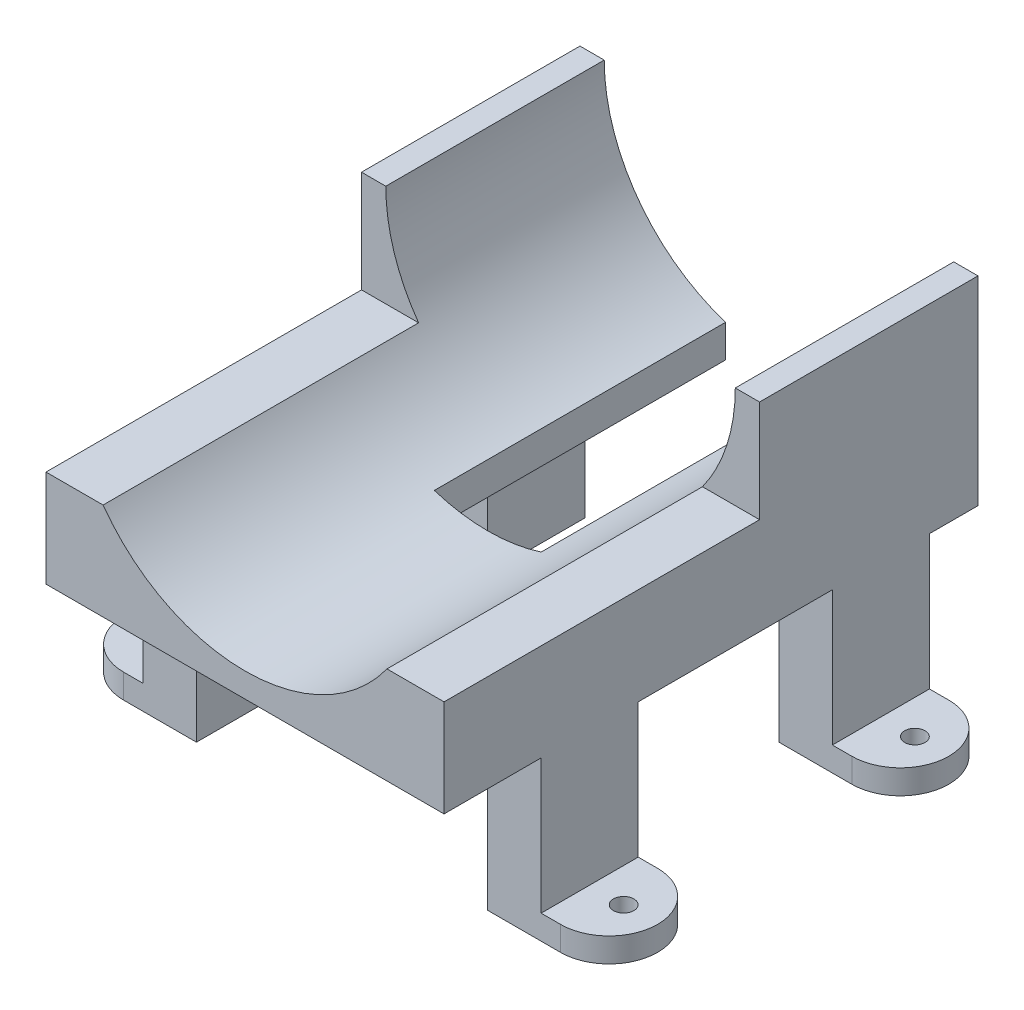
from build123d import *

# Parameters (mm, degrees)
SKETCH_1_R               = 36
EXTRUDE_1_DEPTH          = 90
SKETCH_2_W               = 22
SKETCH_2_H               = 6.721726998
CUT_EXTRUDE_1_DEPTH      = 60
CUT_EXTRUDE_2_DEPTH      = 108.060730429
CUT_EXTRUDE_2_DEPTH_BACK = 108.060730429
EXTRUDE_3_DEPTH          = 20
SKETCH_5_R               = 2.1
CUT_EXTRUDE_3_DEPTH      = 126.87569265
PATTERN_LINEAR_1_COUNT   = 2
PATTERN_LINEAR_1_PITCH   = 60
EXTRUDE_4_DEPTH          = 20


with BuildPart() as part:
    # 草圖1 → 填料-伸長1 (new body)
    with BuildSketch(Plane.XY):
        with BuildLine():
            Line((-41, 0), (-41, -41))
            Line((-41, -41), (41, -41))
            Line((41, -41), (41, 0))
            ThreePointArc((41, 0), (0, 41), (-41, 0))
        make_face()
        Circle(SKETCH_1_R, mode=Mode.SUBTRACT)
    extrude(amount=EXTRUDE_1_DEPTH)

    # 草圖2 → 除料-伸長1 (cut)
    with BuildSketch(Plane.XY):
        with Locations((0, -37.639136501)):
            Rectangle(SKETCH_2_W, SKETCH_2_H)
    extrude(amount=CUT_EXTRUDE_1_DEPTH, mode=Mode.SUBTRACT)

    # 草圖3 → 除料-伸長2 (cut, two sides: drawn at the far end of the back side and taken through both)
    with BuildSketch(Plane(origin=(0, 0, 0), x_dir=(0, 0, -1), z_dir=(1, 0, 0)).offset(-CUT_EXTRUDE_2_DEPTH_BACK)):
        Polygon((0, 41), (-90, 41), (-90, -21), (-45, -21), (-45, 0), (0, 0), align=None)
    extrude(amount=CUT_EXTRUDE_2_DEPTH + CUT_EXTRUDE_2_DEPTH_BACK, mode=Mode.SUBTRACT)

    # 草圖4 → 填料-伸長3 (add)
    with BuildSketch(Plane.XY.offset(90)):
        with BuildLine():
            Line((-30, -73.7), (-30, -27.946386022))
            ThreePointArc((-30, -27.946386022), (-32.791276328, -24.611637258), (-35.213640705, -21))
            Line((-35.213640705, -21), (-41, -21))
            Line((-41, -21), (-41, -68.7))
            Line((-41, -68.7), (-55, -68.7))
            Line((-55, -68.7), (-55, -73.7))
            Line((-55, -73.7), (-30, -73.7))
        make_face()
        with BuildLine():
            Line((30, -73.7), (30, -27.946386022))
            ThreePointArc((30, -27.946386022), (32.791276328, -24.611637258), (35.213640705, -21))
            Line((35.213640705, -21), (41, -21))
            Line((41, -21), (41, -68.7))
            Line((41, -68.7), (55, -68.7))
            Line((55, -68.7), (55, -73.7))
            Line((55, -73.7), (30, -73.7))
        make_face()
    extrude_3 = extrude(amount=-EXTRUDE_3_DEPTH)

    # 草圖5 → 除料-伸長3 (cut, through all)
    with BuildSketch(Plane(origin=(0, -68.7, 0), x_dir=(1, 0, 0), z_dir=(0, 1, 0))):
        with Locations((-48, -80)):
            Circle(SKETCH_5_R)
        with Locations((48, -80)):
            Circle(SKETCH_5_R)
        with BuildLine():
            Line((45, -70), (45, -66.851466146))
            Line((45, -66.851466146), (57.675759509, -66.851466146))
            Line((57.675759509, -66.851466146), (57.675759509, -92.046945096))
            Line((57.675759509, -92.046945096), (45, -92.046945096))
            Line((45, -92.046945096), (45, -90))
            ThreePointArc((45, -90), (55, -80), (45, -70))
        make_face()
        with BuildLine():
            Line((-57.675759509, -92.046945096), (-45, -92.046945096))
            Line((-45, -92.046945096), (-45, -90))
            ThreePointArc((-45, -90), (-55, -80), (-45, -70))
            Line((-45, -70), (-45, -66.851466146))
            Line((-45, -66.851466146), (-57.675759509, -66.851466146))
            Line((-57.675759509, -66.851466146), (-57.675759509, -92.046945096))
        make_face()
    cut_extrude_3 = extrude(amount=-CUT_EXTRUDE_3_DEPTH, mode=Mode.SUBTRACT)

    # 直線複製排列1: 填料-伸長3, 除料-伸長3 ×2
    with Locations(*[(0, 0, -i * PATTERN_LINEAR_1_PITCH) for i in range(1, PATTERN_LINEAR_1_COUNT)]):
        add(extrude_3)
        add(cut_extrude_3, mode=Mode.SUBTRACT)

    # 草圖6 → 填料-伸長4 (add)
    with BuildSketch(Plane.XY.offset(90)):
        with BuildLine():
            Line((-29.240383034, -21), (-41.000001526, -21))
            Line((-41.000001526, -21), (-41, -41))
            Line((-41, -41), (41, -41))
            Line((41, -41), (41, -21))
            Line((41, -21), (29.240383034, -21))
            ThreePointArc((29.240383034, -21), (0, -36), (-29.240383034, -21))
        make_face()
    extrude(amount=EXTRUDE_4_DEPTH)


solid = part.part
